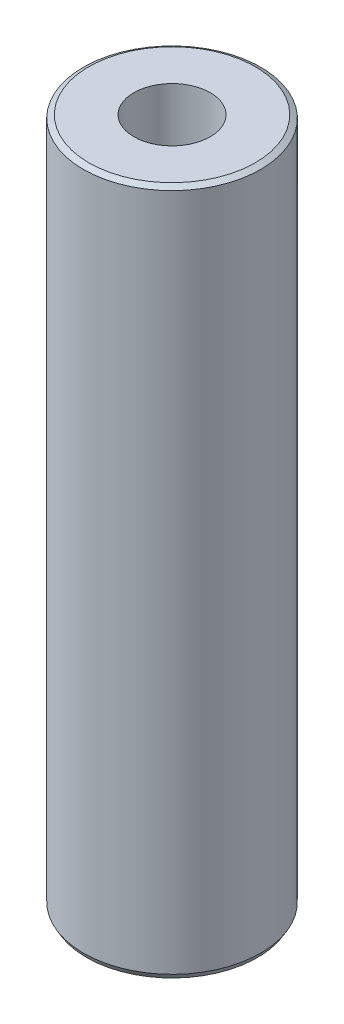
from build123d import *
from OCP.BRepFilletAPI import BRepFilletAPI_MakeChamfer

# Parameters (mm, degrees)
SKETCH1_R           = 57.5
BOSS_EXTRUDE1_DEPTH = 445.852321358
SKETCH2_R           = 24.782821918
CUT_EXTRUDE1_DEPTH  = 454.207229047
CHAMFER1_SIZE       = 2.010177264
CHAMFER1_SIZE2      = 3.481729153


with BuildPart() as part:
    # Sketch1 → Boss-Extrude1 (new body)
    with BuildSketch(Plane(origin=(0, 0, 0), x_dir=(1, 0, 0), z_dir=(0, 1, 0))):
        Circle(SKETCH1_R)
    extrude(amount=BOSS_EXTRUDE1_DEPTH)

    # Sketch2 → Cut-Extrude1 (cut, through all)
    with BuildSketch(Plane(origin=(0, 0, 0), x_dir=(1, 0, 0), z_dir=(0, 1, 0))):
        Circle(SKETCH2_R)
    extrude(amount=CUT_EXTRUDE1_DEPTH, mode=Mode.SUBTRACT)

    # Chamfer1: one chamfer whose edges measure the first distance from different faces: ONE call of the kernel's chamfer builder (chamfer() names one face for all edges)
    chamfer1_edges_1 = [part.edges().sort_by_distance(p)[0] for p in [
        (-57.5, 445.852321358, 0),
    ]]
    chamfer1_side_1 = [part.faces().sort_by_distance(p)[0] for p in [
        (-57.5, 222.926160679, 0),
    ]]
    chamfer1_edges_2 = [part.edges().sort_by_distance(p)[0] for p in [
        (-57.5, 0, 0),
    ]]
    chamfer1_side_2 = [part.faces().sort_by_distance(p)[0] for p in [
        (-55.873654403, 0, 0),
    ]]
    chamfer1 = BRepFilletAPI_MakeChamfer(part.part.solid().wrapped)
    for e in chamfer1_edges_1:
        chamfer1.Add(CHAMFER1_SIZE, CHAMFER1_SIZE2, e.wrapped, chamfer1_side_1[0].wrapped)  # the first distance lies on this face
    for e in chamfer1_edges_2:
        chamfer1.Add(CHAMFER1_SIZE, CHAMFER1_SIZE2, e.wrapped, chamfer1_side_2[0].wrapped)  # the first distance lies on this face
    add(Compound.cast(chamfer1.Shape()), mode=Mode.REPLACE)


solid = part.part
